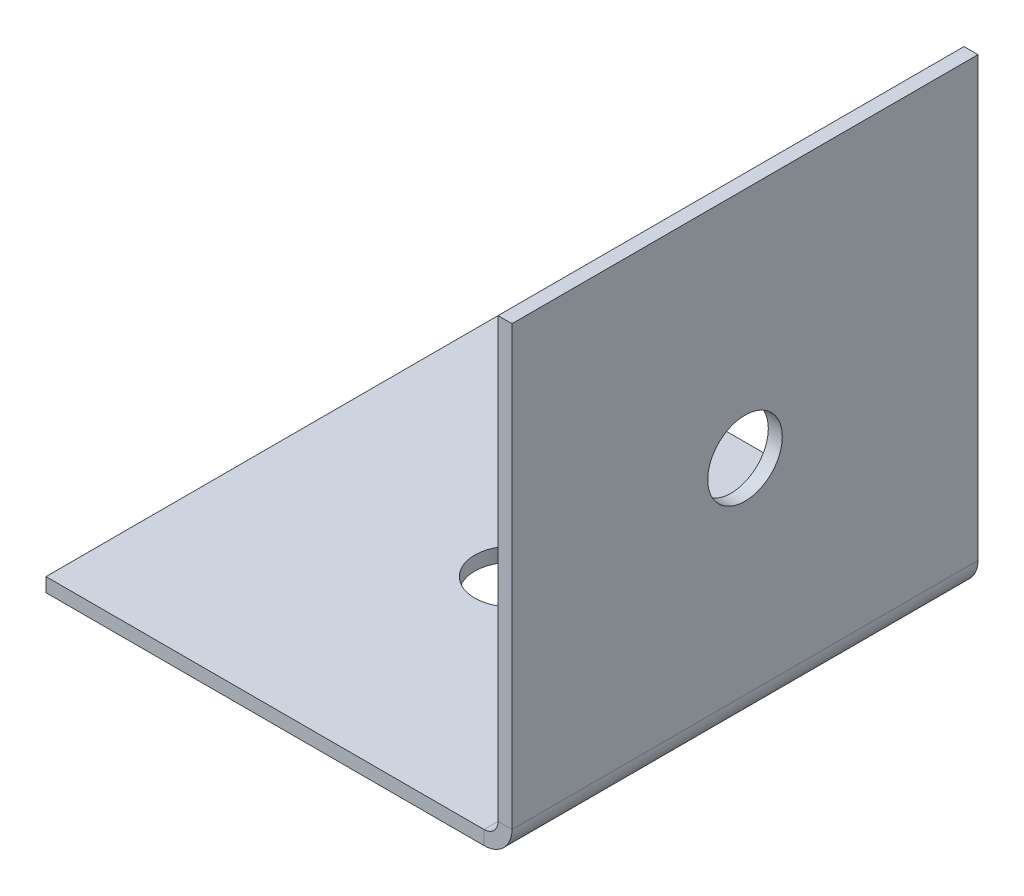
from build123d import *

# Parameters (mm, degrees)
SKETCH1_W              = 25.4
SKETCH1_H              = 25.4
SKETCH1_R              = 2.032
BOSS_EXTRUDE1_DEPTH    = 0.762
SKETCH2_W              = 25.4
SKETCH2_H              = 25.4
SKETCH2_R              = 2.032
BOSS_EXTRUDE2_DEPTH    = 0.762
CONVERT_SOLID1_START   = -12.7
CONVERT_SOLID1_DEPTH   = 25.4
CONVERT_SOLID1_2_DEPTH = 25.4


# Read off the part's stored shape, not the designer's step: Convert-Solid1
with BuildPart() as part:
    # Sketch1 → Boss-Extrude1 (new body)
    with BuildSketch(Plane(origin=(0, 0, 0), x_dir=(1, 0, 0), z_dir=(0, 1, 0))):
        Rectangle(SKETCH1_W, SKETCH1_H)
        with Locations(Location((0, 0, 0), (0, 0, 90))):
            Circle(SKETCH1_R, mode=Mode.SUBTRACT)
    extrude(amount=BOSS_EXTRUDE1_DEPTH)

    # Sketch2 → Boss-Extrude2 (add)
    with BuildSketch(Plane(origin=(12.7, 0, 0), x_dir=(0, 0, -1), z_dir=(1, 0, 0))):
        with Locations((0, 12.7)):
            Rectangle(SKETCH2_W, SKETCH2_H)
        with Locations((0, 12.7)):
            Circle(SKETCH2_R, mode=Mode.SUBTRACT)
    extrude(amount=-BOSS_EXTRUDE2_DEPTH)

    # Convert-Solid1 outline → Convert-Solid1 (cut)
    with BuildSketch(Plane.XY.offset(CONVERT_SOLID1_START)):
        with BuildLine():
            Line((12.7, 0), (12.7, 1.524))
            ThreePointArc((12.7, 1.524), (12.253630735, 0.446369265), (11.176, 0))
            Line((11.176, 0), (12.7, 0))
        make_face()
    extrude(amount=CONVERT_SOLID1_DEPTH, mode=Mode.SUBTRACT)

    # Convert-Solid1 2 outline → Convert-Solid1 2 (add)
    with BuildSketch(Plane.XY.offset(CONVERT_SOLID1_START)):
        with BuildLine():
            Line((11.938, 0.762), (11.938, 1.524))
            ThreePointArc((11.938, 1.524), (11.714815367, 0.985184633), (11.176, 0.762))
            Line((11.176, 0.762), (11.938, 0.762))
        make_face()
    extrude(amount=CONVERT_SOLID1_2_DEPTH)


solid = part.part
